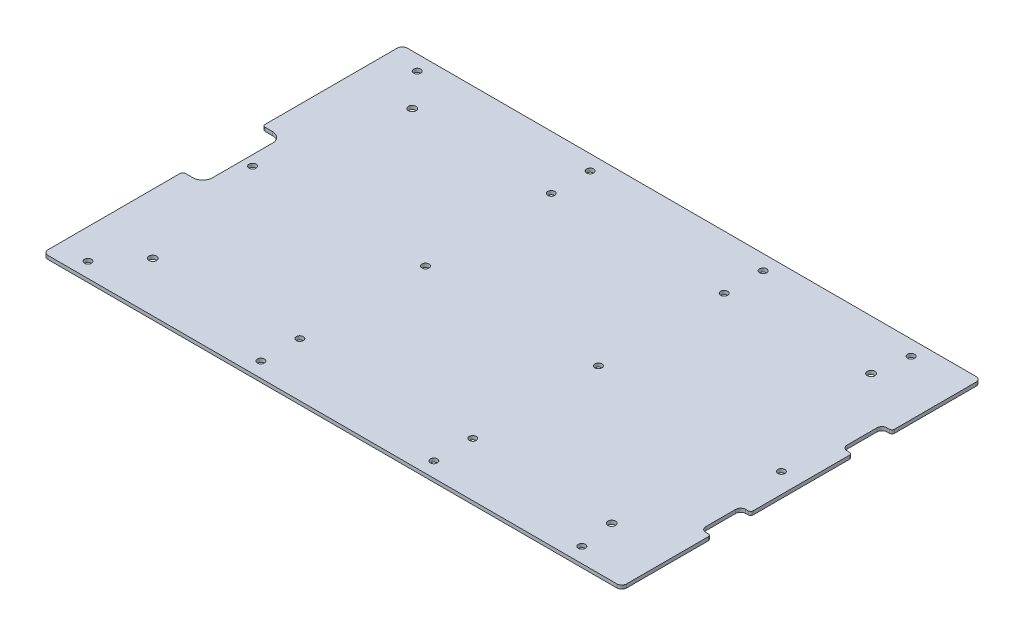
from build123d import *

# Parameters (mm, degrees)
SKETCH1_R           = 2.2479
SKETCH1_R_2         = 2.45745
BOSS_EXTRUDE1_DEPTH = 2.286
CUT_EXTRUDE1_DEPTH  = 217.750866886
FILLET1_R           = 1.5875


with BuildPart() as part:
    # Sketch1 → Boss-Extrude1 (new body)
    with BuildSketch(Plane(origin=(0, 0, 0), x_dir=(1, 0, 0), z_dir=(0, 1, 0))):
        with BuildLine():
            Line((-180.975, 114.3), (180.975, 114.3))
            ThreePointArc((180.975, 114.3), (183.22006403, 113.37006403), (184.15, 111.125))
            Line((184.15, 111.125), (184.15, -111.125))
            ThreePointArc((184.15, -111.125), (183.22006403, -113.37006403), (180.975, -114.3))
            Line((180.975, -114.3), (-180.975, -114.3))
            ThreePointArc((-180.975, -114.3), (-183.22006403, -113.37006403), (-184.15, -111.125))
            Line((-184.15, -111.125), (-184.15, 111.125))
            ThreePointArc((-184.15, 111.125), (-183.22006403, 113.37006403), (-180.975, 114.3))
        make_face()
        with Locations((-165.1, 104.775)):
            Circle(SKETCH1_R, mode=Mode.SUBTRACT)
        with Locations((-55.033333333, 104.775)):
            Circle(SKETCH1_R, mode=Mode.SUBTRACT)
        with Locations((55.033333333, 104.775)):
            Circle(SKETCH1_R, mode=Mode.SUBTRACT)
        with Locations((55.033333333, -104.775)):
            Circle(SKETCH1_R, mode=Mode.SUBTRACT)
        with Locations((-55.033333333, -104.775)):
            Circle(SKETCH1_R, mode=Mode.SUBTRACT)
        with Locations((-165.1, -104.775)):
            Circle(SKETCH1_R, mode=Mode.SUBTRACT)
        with Locations((-55.033333333, 0)):
            Circle(SKETCH1_R, mode=Mode.SUBTRACT)
        with Locations((55.033333333, 0)):
            Circle(SKETCH1_R, mode=Mode.SUBTRACT)
        with Locations((149.225, -104.775)):
            Circle(SKETCH1_R, mode=Mode.SUBTRACT)
        with Locations((149.225, 104.775)):
            Circle(SKETCH1_R, mode=Mode.SUBTRACT)
        with Locations((55.0291, -80.01)):
            Circle(SKETCH1_R, mode=Mode.SUBTRACT)
        with Locations((-55.0291, -80.01)):
            Circle(SKETCH1_R, mode=Mode.SUBTRACT)
        with Locations((-55.0291, 80.01)):
            Circle(SKETCH1_R, mode=Mode.SUBTRACT)
        with Locations((55.0291, 80.01)):
            Circle(SKETCH1_R, mode=Mode.SUBTRACT)
        with Locations((171.45, 0)):
            Circle(SKETCH1_R, mode=Mode.SUBTRACT)
        with Locations((-165.1, 0)):
            Circle(SKETCH1_R, mode=Mode.SUBTRACT)
        with Locations((-146.05, 82.55)):
            Circle(SKETCH1_R_2, mode=Mode.SUBTRACT)
        with Locations((146.05, 82.55)):
            Circle(SKETCH1_R_2, mode=Mode.SUBTRACT)
        with Locations((-146.05, -82.55)):
            Circle(SKETCH1_R_2, mode=Mode.SUBTRACT)
        with Locations((146.05, -82.55)):
            Circle(SKETCH1_R_2, mode=Mode.SUBTRACT)
    extrude(amount=BOSS_EXTRUDE1_DEPTH)

    # Sketch2 → Cut-Extrude1 (cut, through all)
    with BuildSketch(Plane.XZ):
        with BuildLine():
            Line((184.15, 57.658), (180.975, 57.658))
            ThreePointArc((180.975, 57.658), (178.72993597, 56.72806403), (177.8, 54.483))
            Line((177.8, 54.483), (177.8, 35.433))
            ThreePointArc((177.8, 35.433), (178.72993597, 33.18793597), (180.975, 32.258))
            Line((180.975, 32.258), (184.15, 32.258))
            Line((184.15, 32.258), (184.15, 57.658))
        make_face()
        with BuildLine():
            Line((184.15, -32.258), (180.975, -32.258))
            ThreePointArc((180.975, -32.258), (178.72993597, -33.18793597), (177.8, -35.433))
            Line((177.8, -35.433), (177.8, -54.483))
            ThreePointArc((177.8, -54.483), (178.72993597, -56.72806403), (180.975, -57.658))
            Line((180.975, -57.658), (184.15, -57.658))
            Line((184.15, -57.658), (184.15, -32.258))
        make_face()
        with BuildLine():
            Line((-184.15, 25.4), (-177.8, 25.4))
            ThreePointArc((-177.8, 25.4), (-173.309871939, 23.540128061), (-171.45, 19.05))
            Line((-171.45, 19.05), (-171.45, -19.05))
            ThreePointArc((-171.45, -19.05), (-173.309871939, -23.540128061), (-177.8, -25.4))
            Line((-177.8, -25.4), (-184.15, -25.4))
            Line((-184.15, -25.4), (-184.15, 25.4))
        make_face()
    extrude(amount=-CUT_EXTRUDE1_DEPTH, mode=Mode.SUBTRACT)

    # Fillet1
    fillet1_edges = [part.edges().sort_by_distance(p)[0] for p in [
        (184.15, 1.143, -57.658),
        (184.15, 1.143, -32.258),
        (184.15, 1.143, 32.258),
        (184.15, 1.143, 57.658),
        (-184.15, 1.143, -25.4),
        (-184.15, 1.143, 25.4),
    ]]
    fillet(fillet1_edges, radius=FILLET1_R)


solid = part.part
